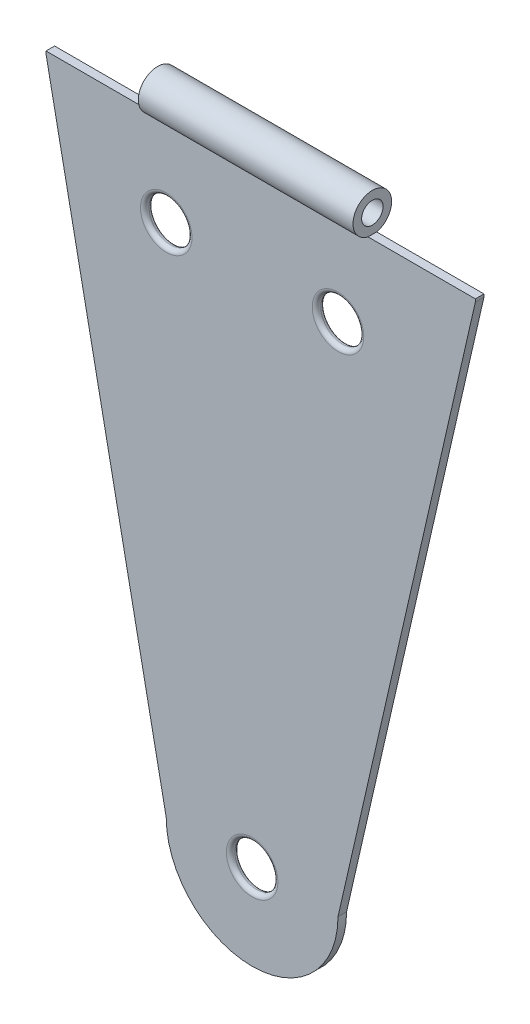
from build123d import *
from build123d.topology import SkipClean

# Parameters (mm, degrees)
ESBO_O1_R                  = 5
RESSALTO_EXTRUS_O1_DEPTH   = 2
FILETE1_R                  = 1
ESBO_O6_W                  = 100
ESBO_O6_H                  = 2
RESSALTO_EXTRUS_O2_DEPTH   = 5
RESSALTO_EXTRUS_O3_DEPTH   = 100
CORTE_EXTRUS_O1_DEPTH      = 189.759767959
CORTE_EXTRUS_O3_DEPTH      = 168.720750058
CORTE_EXTRUS_O3_DEPTH_BACK = 168.720750058
ESBO_O9_W                  = 25
ESBO_O9_H                  = 25


with BuildPart() as part:
    # Esboço1 → Ressalto-extrusão1 (new body)
    with BuildSketch(Plane.XY):
        with BuildLine():
            Line((-50, 0), (50, 0))
            Line((50, 0), (18, -140))
            ThreePointArc((18, -140), (-2, -160), (-22, -140))
            Line((-22, -140), (-50, 0))
        make_face()
        with Locations((-2, -140)):
            Circle(ESBO_O1_R, mode=Mode.SUBTRACT)
        with Locations((-22, -20)):
            Circle(ESBO_O1_R, mode=Mode.SUBTRACT)
        with Locations((18, -20)):
            Circle(ESBO_O1_R, mode=Mode.SUBTRACT)
    extrude(amount=RESSALTO_EXTRUS_O1_DEPTH)

    # Filete1
    filete1_edges = [part.edges().sort_by_distance(p)[0] for p in [
        (-27, -20, 0),
        (-27, -20, 2),
        (13, -20, 0),
        (13, -20, 2),
        (-7, -140, 0),
        (-7, -140, 2),
    ]]
    fillet(filete1_edges, radius=FILETE1_R - 0.0001)  # a hair under: the kernel refuses the full size

    # Esboço6 → Ressalto-extrusão2 (add)
    with BuildSketch(Plane(origin=(0, 0, 0), x_dir=(1, 0, 0), z_dir=(0, 1, 0))):
        with Locations((0, -1)):
            Rectangle(ESBO_O6_W, ESBO_O6_H)
    extrude(amount=RESSALTO_EXTRUS_O2_DEPTH)

    # Esboço7 → Ressalto-extrusão3 (add, through all)
    with BuildSketch(Plane(origin=(50, 0, 0), x_dir=(0, 0, -1), z_dir=(1, 0, 0))):
        with BuildLine():
            ThreePointArc((3.5, 5), (-3.80624304, 8.51781182), (-2, 0.612517806))
            Line((-2, 0.612517806), (-2, 2.708712153))
            ThreePointArc((-2, 2.708712153), (-2.369306394, 7.091650066), (1.5, 5))
            ThreePointArc((1.5, 5), (1.091650066, 3.630693606), (0, 2.708712153))
            Line((0, 2.708712153), (0, 0.612517806))
            ThreePointArc((0, 0.612517806), (2.51781182, 2.19375696), (3.5, 5))
        make_face()
        with BuildLine():
            Line((-2, 2.708712153), (-2, 0.612517806))
            ThreePointArc((-2, 0.612517806), (-1, 0.5), (0, 0.612517806))
            Line((0, 0.612517806), (0, 2.708712153))
            ThreePointArc((0, 2.708712153), (-1, 2.5), (-2, 2.708712153))
        make_face()
    extrude(amount=-RESSALTO_EXTRUS_O3_DEPTH)

    # Esboço8 → Corte-extrusão1 (cut, through all)
    with SkipClean():  # the faces are left unmerged after this step: merging them gives an invalid solid
        with BuildSketch(Plane(origin=(50, 0, 0), x_dir=(0, 0, -1), z_dir=(1, 0, 0))):
            with BuildLine():
                ThreePointArc((-2, 2.708712153), (-1, 7.5), (0, 2.708712153))
                Line((0, 2.708712153), (0, 5))
                Line((0, 5), (-2, 5))
                Line((-2, 5), (-2, 2.708712153))
            make_face()
            with BuildLine():
                Line((0, 5), (0, 2.708712153))
                ThreePointArc((0, 2.708712153), (1.091650066, 3.630693606), (1.5, 5))
                ThreePointArc((1.5, 5), (-2.369306394, 7.091650066), (-2, 2.708712153))
                Line((-2, 2.708712153), (-2, 5))
                Line((-2, 5), (0, 5))
            make_face()
            with BuildLine():
                ThreePointArc((-2, 2.708712153), (-1, 2.5), (0, 2.708712153))
                Line((0, 2.708712153), (0, 5))
                Line((0, 5), (-2, 5))
                Line((-2, 5), (-2, 2.708712153))
            make_face()
        extrude(amount=-CORTE_EXTRUS_O1_DEPTH, mode=Mode.SUBTRACT)

    # Esboço9 → Corte-extrusão3 (cut, two sides: drawn at the far end of the back side and taken through both)
    with BuildSketch(Plane(origin=(0, 0, 0), x_dir=(-1, 0, 0), z_dir=(0, 0, -1)).offset(-CORTE_EXTRUS_O3_DEPTH_BACK)):
        with Locations((-37.5, 13.112517806)):
            Rectangle(ESBO_O9_W, ESBO_O9_H)
        with Locations((37.5, 13.112517806)):
            Rectangle(ESBO_O9_W, ESBO_O9_H)
    extrude(amount=CORTE_EXTRUS_O3_DEPTH + CORTE_EXTRUS_O3_DEPTH_BACK, mode=Mode.SUBTRACT)


solid = part.part
